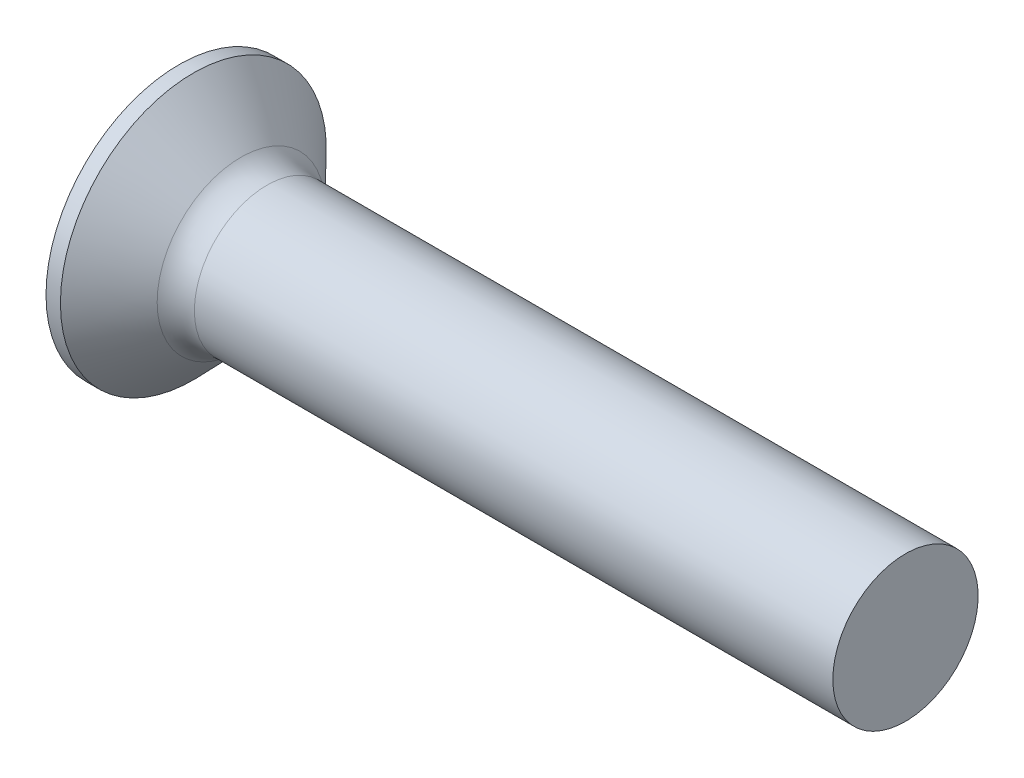
from build123d import *

# Parameters (mm, degrees)
FILLET1_R    = 2.5
RECPAT_COUNT = 2
RECPAT_ANGLE = 90


with BuildPart() as part:
    # BodySke → Base-Revolve (revolve)
    with BuildSketch(Plane.XY):
        Polygon((0, 0), (0, 9.15), (0.992391585, 9.15), (5, 5), (50, 5), (50, 0), align=None)
    revolve(axis=Axis((-6.35, 0, 0), (1, 0, 0)))

    # Fillet1
    fillet1_edges = [part.edges().sort_by_distance(p)[0] for p in [
        (5, -5, 0),
    ]]
    fillet(fillet1_edges, radius=FILLET1_R)

    # Sketch3 → Recess section 0
    with BuildSketch(Plane.ZY):
        with BuildLine():
            Line((-1.08, 4.9), (1.08, 4.9))
            Line((1.08, 4.9), (1.08, -4.9))
            Line((1.08, -4.9), (-1.08, -4.9))
            Line((-1.08, -4.9), (-1.08, 4.9))
        make_face()
    # Sketch4 → Recess section 1
    with BuildSketch(Plane.ZY.offset(-5.64)):
        with BuildLine():
            Line((-1.08, 2.088000201), (1.08, 2.088000201))
            Line((1.08, 2.088000201), (1.08, -2.088000201))
            Line((1.08, -2.088000201), (-1.08, -2.088000201))
            Line((-1.08, -2.088000201), (-1.08, 2.088000201))
        make_face()
    recess = loft(mode=Mode.SUBTRACT)

    # RecPat: Recess ×2 about axis
    recpat_axis = Axis((0, 0, 0), (1, 0, 0))
    for i in range(1, RECPAT_COUNT):
        add(recess.rotate(recpat_axis, i * RECPAT_ANGLE / (RECPAT_COUNT - 1)), mode=Mode.SUBTRACT)

    # RecCorSke → RecessCore (revolve, cut)
    with BuildSketch(Plane.XY):
        Polygon((0, 0), (0, 2.324887219), (5.64, 1.9305), (6.267257474, 0), align=None)
    revolve(axis=Axis((-3.175, 0, 0), (1, 0, 0)), mode=Mode.SUBTRACT)


solid = part.part
